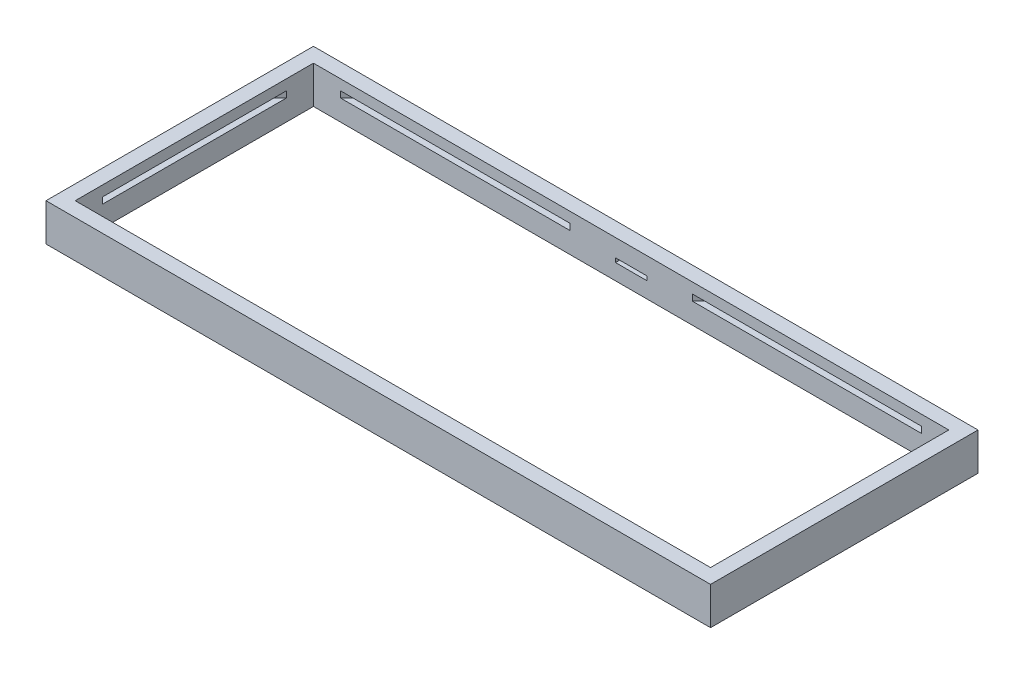
from build123d import *

# Parameters (mm, degrees)
SKETCH1_W           = 318.8
SKETCH1_H           = 128.3
SKETCH1_W_2         = 304.8
SKETCH1_H_2         = 114.3
BOSS_EXTRUDE1_DEPTH = 8
SKETCH2_W           = 110
SKETCH2_H           = 3
SKETCH2_W_2         = 3
SKETCH2_H_2         = 88.3
CUT_EXTRUDE1_DEPTH  = 3
CHAMFER1_SIZE       = 3
SKETCH3_W           = 318.8
SKETCH3_H           = 128.3
SKETCH3_W_2         = 304.8
SKETCH3_H_2         = 114.3
BOSS_EXTRUDE3_DEPTH = 10
SKETCH4_W           = 15
SKETCH4_H           = 2
CUT_EXTRUDE3_DEPTH  = 7


with BuildPart() as part:
    # Sketch1 → Boss-Extrude1 (new body)
    with BuildSketch(Plane(origin=(0, 0, 0), x_dir=(1, 0, 0), z_dir=(0, 1, 0))):
        with Locations((159.4, -64.15)):
            Rectangle(SKETCH1_W, SKETCH1_H)
        with Locations((159.4, -64.15)):
            Rectangle(SKETCH1_W_2, SKETCH1_H_2, mode=Mode.SUBTRACT)
    extrude(amount=BOSS_EXTRUDE1_DEPTH)

    # Sketch2 → Cut-Extrude1 (cut)
    with BuildSketch(Plane.XZ):
        with Locations((75, 122.8)):
            Rectangle(SKETCH2_W, SKETCH2_H)
        with Locations((5.5, 64.15)):
            Rectangle(SKETCH2_W_2, SKETCH2_H_2)
        with Locations((313.3, 64.15)):
            Rectangle(SKETCH2_W_2, SKETCH2_H_2)
        with Locations((75, 5.5)):
            Rectangle(SKETCH2_W, SKETCH2_H)
        with Locations((243.8, 5.5)):
            Rectangle(SKETCH2_W, SKETCH2_H)
        with Locations((243.8, 122.8)):
            Rectangle(SKETCH2_W, SKETCH2_H)
    extrude(amount=-CUT_EXTRUDE1_DEPTH, mode=Mode.SUBTRACT)

    # Chamfer1
    chamfer1_edges = [part.edges().sort_by_distance(p)[0] for p in [
        (298.8, 1.5, 4),
        (314.8, 1.5, 20),
        (130, 1.5, 4),
        (188.8, 1.5, 4),
        (20, 1.5, 4),
        (4, 1.5, 20),
        (4, 1.5, 108.3),
        (314.8, 1.5, 108.3),
        (298.8, 1.5, 124.3),
        (188.8, 1.5, 124.3),
        (130, 1.5, 124.3),
        (20, 1.5, 124.3),
    ]]
    chamfer(chamfer1_edges, length=CHAMFER1_SIZE - 0.0001)  # a hair under: the kernel refuses the full size

    # Sketch3 → Boss-Extrude3 (add)
    with BuildSketch(Plane.XZ):
        with Locations((159.4, 64.15)):
            Rectangle(SKETCH3_W, SKETCH3_H)
        with Locations((159.4, 64.15)):
            Rectangle(SKETCH3_W_2, SKETCH3_H_2, mode=Mode.SUBTRACT)
    extrude(amount=BOSS_EXTRUDE3_DEPTH)

    # Sketch4 → Cut-Extrude3 (cut)
    with BuildSketch(Plane(origin=(0, 0, 0), x_dir=(-1, 0, 0), z_dir=(0, 0, -1))):
        with Locations((-159.4, -1.4)):
            Rectangle(SKETCH4_W, SKETCH4_H)
    extrude(amount=-CUT_EXTRUDE3_DEPTH, mode=Mode.SUBTRACT)


solid = part.part
